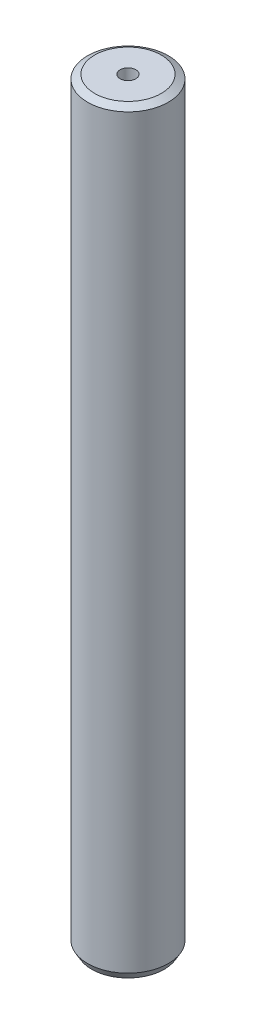
from build123d import *
from OCP.BRepFilletAPI import BRepFilletAPI_MakeChamfer

# Parameters (mm, degrees)
SKETCH1_R           = 5
BOSS_EXTRUDE1_DEPTH = 93.781609255
SKETCH2_R           = 0.971554326
CUT_EXTRUDE1_DEPTH  = 95.047808238
CHAMFER1_SIZE       = 0.504927523
CHAMFER1_SIZE2      = 0.874560124


with BuildPart() as part:
    # Sketch1 → Boss-Extrude1 (new body)
    with BuildSketch(Plane(origin=(0, 0, 0), x_dir=(1, 0, 0), z_dir=(0, 1, 0))):
        Circle(SKETCH1_R)
    extrude(amount=BOSS_EXTRUDE1_DEPTH)

    # Sketch2 → Cut-Extrude1 (cut, through all)
    with BuildSketch(Plane(origin=(0, 0, 0), x_dir=(1, 0, 0), z_dir=(0, 1, 0))):
        Circle(SKETCH2_R)
    extrude(amount=CUT_EXTRUDE1_DEPTH, mode=Mode.SUBTRACT)

    # Chamfer1: one chamfer whose edges measure the first distance from different faces: ONE call of the kernel's chamfer builder (chamfer() names one face for all edges)
    chamfer1_edges_1 = [part.edges().sort_by_distance(p)[0] for p in [
        (-5, 93.781609255, 0),
    ]]
    chamfer1_side_1 = [part.faces().sort_by_distance(p)[0] for p in [
        (-5, 46.890804627, 0),
    ]]
    chamfer1_edges_2 = [part.edges().sort_by_distance(p)[0] for p in [
        (-5, 0, 0),
    ]]
    chamfer1_side_2 = [part.faces().sort_by_distance(p)[0] for p in [
        (-4.858578644, 0, 0),
    ]]
    chamfer1 = BRepFilletAPI_MakeChamfer(part.part.solid().wrapped)
    for e in chamfer1_edges_1:
        chamfer1.Add(CHAMFER1_SIZE, CHAMFER1_SIZE2, e.wrapped, chamfer1_side_1[0].wrapped)  # the first distance lies on this face
    for e in chamfer1_edges_2:
        chamfer1.Add(CHAMFER1_SIZE, CHAMFER1_SIZE2, e.wrapped, chamfer1_side_2[0].wrapped)  # the first distance lies on this face
    add(Compound.cast(chamfer1.Shape()), mode=Mode.REPLACE)


solid = part.part
